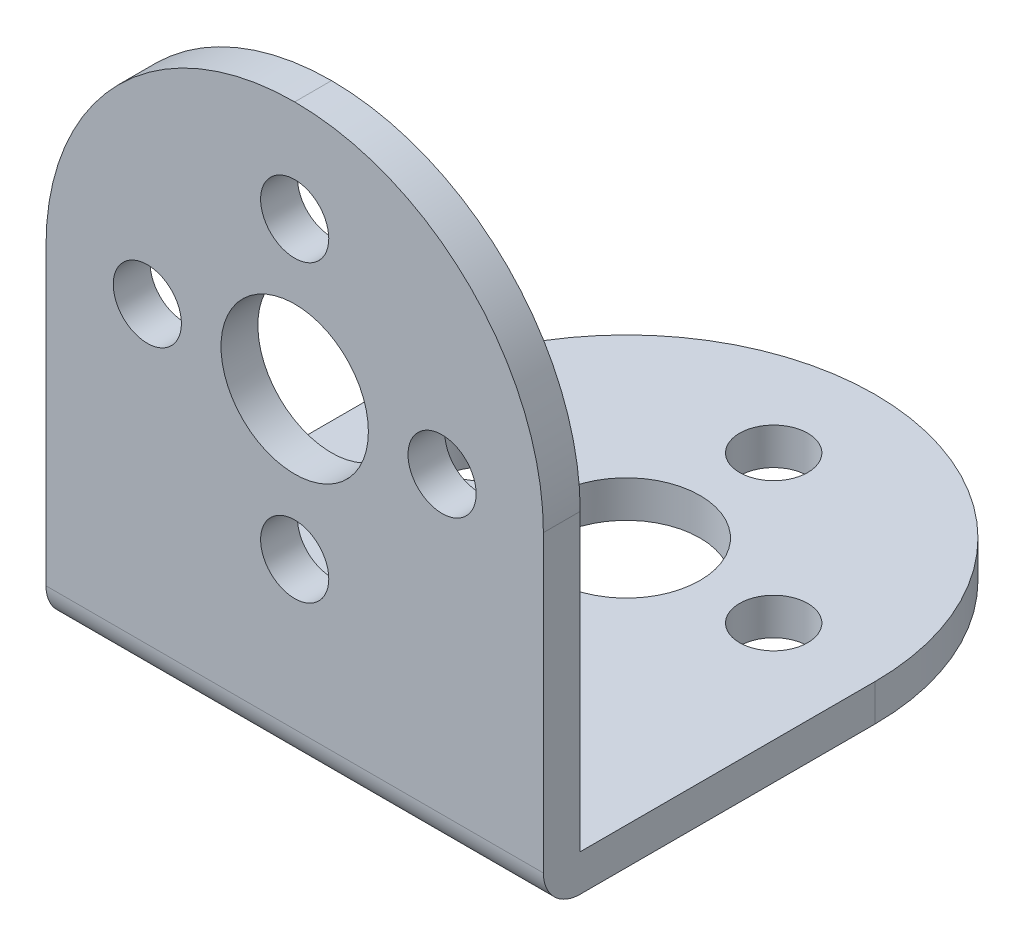
from build123d import *

# Parameters (mm, degrees)
EXTRUDE1_DEPTH           = 27
CUT_EXTRUDE1_START       = -2
CUT_EXTRUDE1_OUTLINE_R   = 4
CUT_EXTRUDE1_OUTLINE_R_2 = 1.85
CUT_EXTRUDE1_DEPTH       = 2
CUT_EXTRUDE2_START       = -2
CUT_EXTRUDE2_OUTLINE_R   = 4
CUT_EXTRUDE2_OUTLINE_R_2 = 1.85
CUT_EXTRUDE2_DEPTH       = 2
FILLET1_R                = 13.5
FILLET2_R                = 13.5
FILLET3_R                = 13.5
FILLET4_R                = 13.5
FILLET5_R                = 2


# Read off the part's stored shape, not the designer's step: Cut-Extrude1, Cut-Extrude2
with BuildPart() as part:
    # Sketch1 → Extrude1 (new body)
    with BuildSketch(Plane(origin=(0, 0, 0), x_dir=(0, 0, -1), z_dir=(1, 0, 0))):
        Polygon((0, 0), (31.5, 0), (31.5, 2), (2, 2), (2, 31.5), (0, 31.5), align=None)
    extrude(amount=-EXTRUDE1_DEPTH)

    # Cut-Extrude1 outline → Cut-Extrude1 (cut)
    with BuildSketch(Plane.XY.offset(CUT_EXTRUDE1_START)):
        with Locations((-13.5, 18)):
            Circle(CUT_EXTRUDE1_OUTLINE_R)
        with Locations((-5.5, 18)):
            Circle(CUT_EXTRUDE1_OUTLINE_R_2)
        with Locations((-21.5, 18)):
            Circle(CUT_EXTRUDE1_OUTLINE_R_2)
        with Locations((-13.5, 10)):
            Circle(CUT_EXTRUDE1_OUTLINE_R_2)
        with Locations((-13.5, 26)):
            Circle(CUT_EXTRUDE1_OUTLINE_R_2)
    extrude(amount=CUT_EXTRUDE1_DEPTH, mode=Mode.SUBTRACT)

    # Cut-Extrude2 outline → Cut-Extrude2 (cut)
    with BuildSketch(Plane.XZ.offset(CUT_EXTRUDE2_START)):
        with Locations((-13.5, -18)):
            Circle(CUT_EXTRUDE2_OUTLINE_R)
        with Locations((-5.5, -18)):
            Circle(CUT_EXTRUDE2_OUTLINE_R_2)
        with Locations((-21.5, -18)):
            Circle(CUT_EXTRUDE2_OUTLINE_R_2)
        with Locations((-13.5, -26)):
            Circle(CUT_EXTRUDE2_OUTLINE_R_2)
        with Locations((-13.5, -10)):
            Circle(CUT_EXTRUDE2_OUTLINE_R_2)
    extrude(amount=CUT_EXTRUDE2_DEPTH, mode=Mode.SUBTRACT)

    # Fillet1
    fillet1_edges = [part.edges().sort_by_distance(p)[0] for p in [
        (0, 31.5, -1),
    ]]
    fillet(fillet1_edges, radius=FILLET1_R)

    # Fillet2
    fillet2_edges = [part.edges().sort_by_distance(p)[0] for p in [
        (-27, 31.5, -1),
    ]]
    fillet(fillet2_edges, radius=FILLET2_R - 0.0001)  # a hair under: the kernel refuses the full size

    # Fillet3
    fillet3_edges = [part.edges().sort_by_distance(p)[0] for p in [
        (0, 1, -31.5),
    ]]
    fillet(fillet3_edges, radius=FILLET3_R)

    # Fillet4
    fillet4_edges = [part.edges().sort_by_distance(p)[0] for p in [
        (-27, 1, -31.5),
    ]]
    fillet(fillet4_edges, radius=FILLET4_R - 0.0001)  # a hair under: the kernel refuses the full size

    # Fillet5
    fillet5_edges = [part.edges().sort_by_distance(p)[0] for p in [
        (-13.5, 0, 0),
    ]]
    fillet(fillet5_edges, radius=FILLET5_R)


solid = part.part
